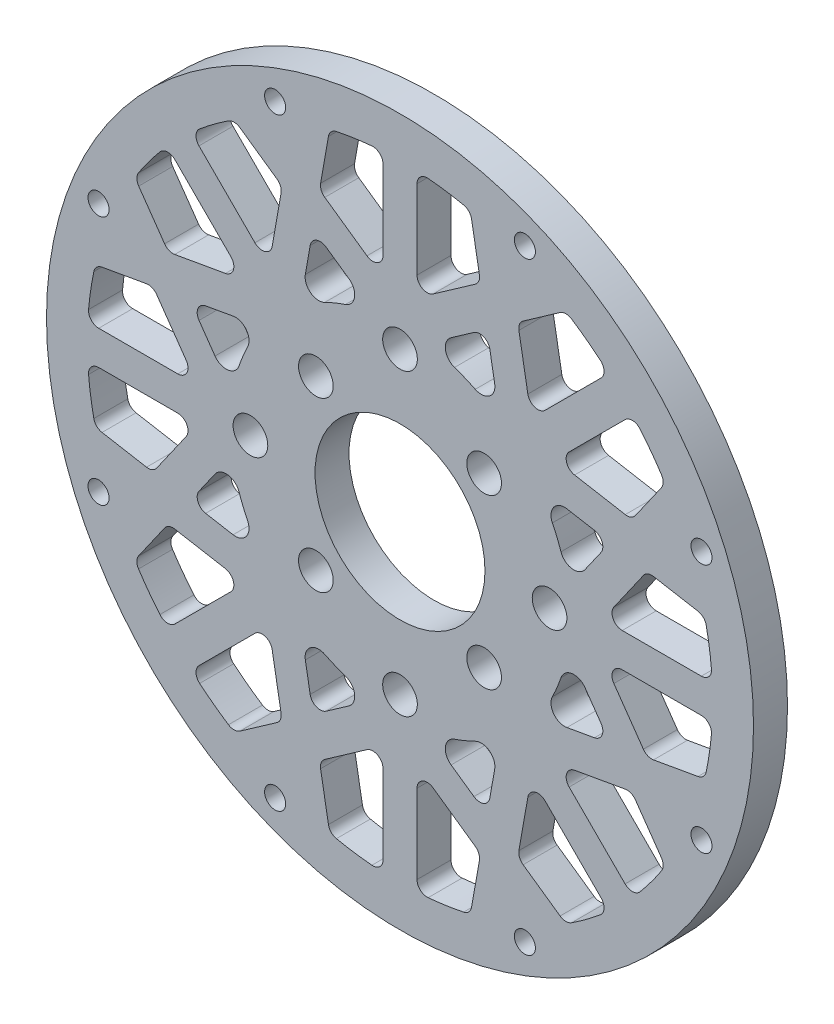
from build123d import *

# Parameters (mm, degrees)
SKETCH_1_R               = 70
EXTRUDE_1_DEPTH          = 5
SKETCH_3_R               = 12.5
CUT_EXTRUDE_2_DEPTH      = 100.121138008
SKETCH_4_R               = 65
SKETCH_4_R_2             = 25
CUT_EXTRUDE_3_DEPTH      = 100.121138008
EXTRUDE_START            = -5
EXTRUDE_4_DEPTH          = 5
SKETCH_8_R               = 65
SKETCH_8_R_2             = 59
EXTRUDE_2_DEPTH          = 5
FILLET_1_R               = 2
FILLET_2_R               = 1.5
FILLET_3_R               = 1.5
SKETCH_9_R               = 1.5
CUT_EXTRUDE_4_DEPTH      = 100.121138008
PATTERN_CIRCULAR_2_COUNT = 18
SKETCH_2_R               = 2.55
CUT_EXTRUDE_1_DEPTH      = 100.121138008
PATTERN_CIRCULAR_1_COUNT = 4
SKETCH_10_R              = 70
SKETCH_10_R_2            = 52
CUT_EXTRUDE_5_DEPTH      = 100.121138008
SKETCH_11_R              = 52
SKETCH_11_R_2            = 46
EXTRUDE_3_DEPTH          = 5
SKETCH_12_R              = 1.55
CUT_EXTRUDE_6_DEPTH      = 74.708886845
PATTERN_CIRCULAR_3_COUNT = 8
EXTRUDE_4_2_DEPTH        = 5
FILLET_4_R               = 1.5


# Read off the part's stored shape, not the designer's step: 拉伸-薄壁4
with BuildPart() as part:
    # 草图1 → 凸台-拉伸1 (new body)
    with BuildSketch(Plane.XY):
        Circle(SKETCH_1_R)
    extrude(amount=EXTRUDE_1_DEPTH)

    # 草图3 → 切除-拉伸2 (cut, through all)
    with BuildSketch(Plane.XY.offset(5)):
        Circle(SKETCH_3_R)
    extrude(amount=-CUT_EXTRUDE_2_DEPTH, mode=Mode.SUBTRACT)

    # 草图4 → 切除-拉伸3 (cut, through all)
    with BuildSketch(Plane.XY.offset(5)):
        Circle(SKETCH_4_R)
        Circle(SKETCH_4_R_2, mode=Mode.SUBTRACT)
    extrude(amount=-CUT_EXTRUDE_3_DEPTH, mode=Mode.SUBTRACT)


with BuildPart() as cut_extrude_3_piece_1:
    # of the separate pieces the step leaves, piece 1, a body of its own (cut_extrude_3_pieces)
    add(part.part.solids().sort_by_distance((70, 0, 0))[0])



with BuildPart() as cut_extrude_3_piece_2:
    # of the separate pieces the step leaves, piece 2, a body of its own (cut_extrude_3_pieces)
    add(part.part.solids().sort_by_distance((25, 0, 0))[0])


with BuildPart() as cut_extrude_3_piece_1_1:
    add(cut_extrude_3_piece_1.part)

    add(cut_extrude_3_piece_2.part)  # Extrude 4 merges 切除-拉伸3 piece 2
    # Extrude 4 outline → Extrude 4 (add)
    with BuildSketch(Plane.XY.offset(5).offset(EXTRUDE_START)):
        with BuildLine():
            Line((-17.324297637, 34.078667328), (-19.305751298, 22.841285204))
            Line((-19.305751298, 22.841285204), (-44.160165724, 47.69569963))
            ThreePointArc((-44.160165724, 47.69569963), (-45.961940777, 45.961940777), (-47.69569963, 44.160165724))
            Line((-47.69569963, 44.160165724), (-22.841285204, 19.305751298))
            Line((-22.841285204, 19.305751298), (-34.078667328, 17.324297637))
            Line((-34.078667328, 17.324297637), (-50.111128196, 40.221024669))
            Line((-50.111128196, 40.221024669), (-52.159008306, 38.787083578))
            ThreePointArc((-52.159008306, 38.787083578), (-52.939605533, 37.714694299), (-53.698157945, 36.626600078))
            Line((-53.698157945, 36.626600078), (-39.511742973, 16.366299813))
            Line((-39.511742973, 16.366299813), (-63.869248907, 12.071414334))
            ThreePointArc((-63.869248907, 12.071414334), (-64.102270154, 10.765637977), (-64.308598294, 9.455378653))
            Line((-64.308598294, 9.455378653), (-63.87447785, 6.993359271))
            Line((-63.87447785, 6.993359271), (-36.3473851, 11.847128423))
            Line((-36.3473851, 11.847128423), (-29.802455317, 2.5))
            Line((-29.802455317, 2.5), (-64.951905284, 2.5))
            ThreePointArc((-64.951905284, 2.5), (-65, 0), (-64.951905284, -2.5))
            Line((-64.951905284, -2.5), (-29.802455317, -2.5))
            Line((-29.802455317, -2.5), (-36.3473851, -11.847128423))
            Line((-36.3473851, -11.847128423), (-63.87447785, -6.993359271))
            Line((-63.87447785, -6.993359271), (-64.308598294, -9.455378653))
            ThreePointArc((-64.308598294, -9.455378653), (-64.102270154, -10.765637977), (-63.869248907, -12.071414334))
            Line((-63.869248907, -12.071414334), (-39.511742973, -16.366299813))
            Line((-39.511742973, -16.366299813), (-53.698157945, -36.626600078))
            ThreePointArc((-53.698157945, -36.626600078), (-52.939605533, -37.714694299), (-52.159008306, -38.787083578))
            Line((-52.159008306, -38.787083578), (-50.111128196, -40.221024669))
            Line((-50.111128196, -40.221024669), (-34.078667328, -17.324297637))
            Line((-34.078667328, -17.324297637), (-22.841285204, -19.305751298))
            Line((-22.841285204, -19.305751298), (-47.69569963, -44.160165724))
            ThreePointArc((-47.69569963, -44.160165724), (-45.961940777, -45.961940777), (-44.160165724, -47.69569963))
            Line((-44.160165724, -47.69569963), (-19.305751298, -22.841285204))
            Line((-19.305751298, -22.841285204), (-17.324297637, -34.078667328))
            Line((-17.324297637, -34.078667328), (-40.221024669, -50.111128196))
            Line((-40.221024669, -50.111128196), (-38.787083578, -52.159008306))
            ThreePointArc((-38.787083578, -52.159008306), (-37.714694299, -52.939605533), (-36.626600078, -53.698157945))
            Line((-36.626600078, -53.698157945), (-16.366299813, -39.511742973))
            Line((-16.366299813, -39.511742973), (-12.071414334, -63.869248907))
            ThreePointArc((-12.071414334, -63.869248907), (-10.765637977, -64.102270154), (-9.455378653, -64.308598294))
            Line((-9.455378653, -64.308598294), (-6.993359271, -63.87447785))
            Line((-6.993359271, -63.87447785), (-11.847128423, -36.3473851))
            Line((-11.847128423, -36.3473851), (-2.5, -29.802455317))
            Line((-2.5, -29.802455317), (-2.5, -64.951905284))
            ThreePointArc((-2.5, -64.951905284), (0, -65), (2.5, -64.951905284))
            Line((2.5, -64.951905284), (2.5, -29.802455317))
            Line((2.5, -29.802455317), (11.847128423, -36.3473851))
            Line((11.847128423, -36.3473851), (6.993359271, -63.87447785))
            Line((6.993359271, -63.87447785), (9.455378653, -64.308598294))
            ThreePointArc((9.455378653, -64.308598294), (10.765637977, -64.102270154), (12.071414334, -63.869248907))
            Line((12.071414334, -63.869248907), (16.366299813, -39.511742973))
            Line((16.366299813, -39.511742973), (36.626600078, -53.698157945))
            ThreePointArc((36.626600078, -53.698157945), (37.714694299, -52.939605533), (38.787083578, -52.159008306))
            Line((38.787083578, -52.159008306), (40.221024669, -50.111128196))
            Line((40.221024669, -50.111128196), (17.324297637, -34.078667328))
            Line((17.324297637, -34.078667328), (19.305751298, -22.841285204))
            Line((19.305751298, -22.841285204), (44.160165724, -47.69569963))
            ThreePointArc((44.160165724, -47.69569963), (45.961940777, -45.961940777), (47.69569963, -44.160165724))
            Line((47.69569963, -44.160165724), (22.841285204, -19.305751298))
            Line((22.841285204, -19.305751298), (34.078667328, -17.324297637))
            Line((34.078667328, -17.324297637), (50.111128196, -40.221024669))
            Line((50.111128196, -40.221024669), (52.159008306, -38.787083578))
            ThreePointArc((52.159008306, -38.787083578), (52.939605533, -37.714694299), (53.698157945, -36.626600078))
            Line((53.698157945, -36.626600078), (39.511742973, -16.366299813))
            Line((39.511742973, -16.366299813), (63.869248907, -12.071414334))
            ThreePointArc((63.869248907, -12.071414334), (64.102270154, -10.765637977), (64.308598294, -9.455378653))
            Line((64.308598294, -9.455378653), (63.87447785, -6.993359271))
            Line((63.87447785, -6.993359271), (36.3473851, -11.847128423))
            Line((36.3473851, -11.847128423), (29.802455317, -2.5))
            Line((29.802455317, -2.5), (64.951905284, -2.5))
            ThreePointArc((64.951905284, -2.5), (65, 0), (64.951905284, 2.5))
            Line((64.951905284, 2.5), (29.802455317, 2.5))
            Line((29.802455317, 2.5), (36.3473851, 11.847128423))
            Line((36.3473851, 11.847128423), (63.87447785, 6.993359271))
            Line((63.87447785, 6.993359271), (64.308598294, 9.455378653))
            ThreePointArc((64.308598294, 9.455378653), (64.102270154, 10.765637977), (63.869248907, 12.071414334))
            Line((63.869248907, 12.071414334), (39.511742973, 16.366299813))
            Line((39.511742973, 16.366299813), (53.698157945, 36.626600078))
            ThreePointArc((53.698157945, 36.626600078), (52.939605533, 37.714694299), (52.159008306, 38.787083578))
            Line((52.159008306, 38.787083578), (50.111128196, 40.221024669))
            Line((50.111128196, 40.221024669), (34.078667328, 17.324297637))
            Line((34.078667328, 17.324297637), (22.841285204, 19.305751298))
            Line((22.841285204, 19.305751298), (47.69569963, 44.160165724))
            ThreePointArc((47.69569963, 44.160165724), (45.961940777, 45.961940777), (44.160165724, 47.69569963))
            Line((44.160165724, 47.69569963), (19.305751298, 22.841285204))
            Line((19.305751298, 22.841285204), (17.324297637, 34.078667328))
            Line((17.324297637, 34.078667328), (40.221024669, 50.111128196))
            Line((40.221024669, 50.111128196), (38.787083578, 52.159008306))
            ThreePointArc((38.787083578, 52.159008306), (37.714694299, 52.939605533), (36.626600078, 53.698157945))
            Line((36.626600078, 53.698157945), (16.366299813, 39.511742973))
            Line((16.366299813, 39.511742973), (12.071414334, 63.869248907))
            ThreePointArc((12.071414334, 63.869248907), (10.765637977, 64.102270154), (9.455378653, 64.308598294))
            Line((9.455378653, 64.308598294), (6.993359271, 63.87447785))
            Line((6.993359271, 63.87447785), (11.847128423, 36.3473851))
            Line((11.847128423, 36.3473851), (2.5, 29.802455317))
            Line((2.5, 29.802455317), (2.5, 64.951905284))
            ThreePointArc((2.5, 64.951905284), (0, 65), (-2.5, 64.951905284))
            Line((-2.5, 64.951905284), (-2.5, 29.802455317))
            Line((-2.5, 29.802455317), (-11.847128423, 36.3473851))
            Line((-11.847128423, 36.3473851), (-6.993359271, 63.87447785))
            Line((-6.993359271, 63.87447785), (-9.455378653, 64.308598294))
            ThreePointArc((-9.455378653, 64.308598294), (-10.765637977, 64.102270154), (-12.071414334, 63.869248907))
            Line((-12.071414334, 63.869248907), (-16.366299813, 39.511742973))
            Line((-16.366299813, 39.511742973), (-36.626600078, 53.698157945))
            ThreePointArc((-36.626600078, 53.698157945), (-37.714694299, 52.939605533), (-38.787083578, 52.159008306))
            Line((-38.787083578, 52.159008306), (-40.221024669, 50.111128196))
            Line((-40.221024669, 50.111128196), (-17.324297637, 34.078667328))
        make_face()
        with BuildLine():
            Line((30.914309454, -12.805126247), (20.22939531, -14.689164897))
            ThreePointArc((20.22939531, -14.689164897), (17.67766953, -17.67766953), (14.689164897, -20.22939531))
            Line((14.689164897, -20.22939531), (12.805126247, -30.914309454))
            Line((12.805126247, -30.914309454), (3.917534494, -24.691150712))
            ThreePointArc((3.917534494, -24.691150712), (0, -25), (-3.917534494, -24.691150712))
            Line((-3.917534494, -24.691150712), (-12.805126247, -30.914309454))
            Line((-12.805126247, -30.914309454), (-14.689164897, -20.22939531))
            ThreePointArc((-14.689164897, -20.22939531), (-17.67766953, -17.67766953), (-20.22939531, -14.689164897))
            Line((-20.22939531, -14.689164897), (-30.914309454, -12.805126247))
            Line((-30.914309454, -12.805126247), (-24.691150712, -3.917534494))
            ThreePointArc((-24.691150712, -3.917534494), (-25, 0), (-24.691150712, 3.917534494))
            Line((-24.691150712, 3.917534494), (-30.914309454, 12.805126247))
            Line((-30.914309454, 12.805126247), (-20.22939531, 14.689164897))
            ThreePointArc((-20.22939531, 14.689164897), (-17.67766953, 17.67766953), (-14.689164897, 20.22939531))
            Line((-14.689164897, 20.22939531), (-12.805126247, 30.914309454))
            Line((-12.805126247, 30.914309454), (-3.917534494, 24.691150712))
            ThreePointArc((-3.917534494, 24.691150712), (0, 25), (3.917534494, 24.691150712))
            Line((3.917534494, 24.691150712), (12.805126247, 30.914309454))
            Line((12.805126247, 30.914309454), (14.689164897, 20.22939531))
            ThreePointArc((14.689164897, 20.22939531), (17.67766953, 17.67766953), (20.22939531, 14.689164897))
            Line((20.22939531, 14.689164897), (30.914309454, 12.805126247))
            Line((30.914309454, 12.805126247), (24.691150712, 3.917534494))
            ThreePointArc((24.691150712, 3.917534494), (25, 0), (24.691150712, -3.917534494))
            Line((24.691150712, -3.917534494), (30.914309454, -12.805126247))
        make_face(mode=Mode.SUBTRACT)
    extrude(amount=EXTRUDE_4_DEPTH)

    # 草图8 → 凸台-拉伸2 (add, through all)
    with BuildSketch(Plane.XY.offset(5)):
        Circle(SKETCH_8_R)
        Circle(SKETCH_8_R_2, mode=Mode.SUBTRACT)
    extrude(amount=-EXTRUDE_2_DEPTH)

    # 圆角1
    fillet_1_edges = [cut_extrude_3_piece_1_1.edges().sort_by_distance(p)[0] for p in [
        (-20.22939531, 14.689164897, 2.5),
        (24.691150712, -3.917534494, 2.5),
        (24.691150712, 3.917534494, 2.5),
        (20.22939531, -14.689164897, 2.5),
        (14.689164897, -20.22939531, 2.5),
        (20.22939531, 14.689164897, 2.5),
        (14.689164897, 20.22939531, 2.5),
        (3.917534494, -24.691150712, 2.5),
        (-3.917534494, -24.691150712, 2.5),
        (3.917534494, 24.691150712, 2.5),
        (-14.689164897, -20.22939531, 2.5),
        (-20.22939531, -14.689164897, 2.5),
        (-24.691150712, -3.917534494, 2.5),
        (-24.691150712, 3.917534494, 2.5),
        (-3.917534494, 24.691150712, 2.5),
        (-14.689164897, 20.22939531, 2.5),
    ]]
    fillet(fillet_1_edges, radius=FILLET_1_R)

    # 圆角2
    fillet_2_edges = [cut_extrude_3_piece_1_1.edges().sort_by_distance(p)[0] for p in [
        (39.511742973, -16.366299813, 2.5),
        (39.511742973, 16.366299813, 2.5),
        (16.366299813, -39.511742973, 2.5),
        (16.366299813, 39.511742973, 2.5),
        (-16.366299813, -39.511742973, 2.5),
        (-39.511742973, -16.366299813, 2.5),
        (-16.366299813, 39.511742973, 2.5),
        (-39.511742973, 16.366299813, 2.5),
        (36.3473851, -11.847128423, 2.5),
        (36.3473851, 11.847128423, 2.5),
        (30.914309454, -12.805126247, 2.5),
        (34.078667328, 17.324297637, 2.5),
        (34.078667328, -17.324297637, 2.5),
        (17.324297637, -34.078667328, 2.5),
        (17.324297637, 34.078667328, 2.5),
        (12.805126247, -30.914309454, 2.5),
        (30.914309454, 12.805126247, 2.5),
        (11.847128423, 36.3473851, 2.5),
        (11.847128423, -36.3473851, 2.5),
        (-11.847128423, -36.3473851, 2.5),
        (-12.805126247, -30.914309454, 2.5),
        (12.805126247, 30.914309454, 2.5),
        (-17.324297637, -34.078667328, 2.5),
        (-34.078667328, -17.324297637, 2.5),
        (-30.914309454, -12.805126247, 2.5),
        (-11.847128423, 36.3473851, 2.5),
        (-36.3473851, -11.847128423, 2.5),
        (-36.3473851, 11.847128423, 2.5),
        (-12.805126247, 30.914309454, 2.5),
        (-30.914309454, 12.805126247, 2.5),
        (-17.324297637, 34.078667328, 2.5),
        (-34.078667328, 17.324297637, 2.5),
    ]]
    fillet(fillet_2_edges, radius=FILLET_2_R)

    # 圆角3
    fillet_3_edges = [cut_extrude_3_piece_1_1.edges().sort_by_distance(p)[0] for p in [
        (-19.305751298, 22.841285204, 2.5),
        (29.802455317, -2.5, 2.5),
        (19.305751298, -22.841285204, 2.5),
        (22.841285204, 19.305751298, 2.5),
        (-2.5, -29.802455317, 2.5),
        (-22.841285204, -19.305751298, 2.5),
        (2.5, 29.802455317, 2.5),
        (-2.5, 29.802455317, 2.5),
        (-29.802455317, 2.5, 2.5),
        (29.802455317, 2.5, 2.5),
        (22.841285204, -19.305751298, 2.5),
        (19.305751298, 22.841285204, 2.5),
        (2.5, -29.802455317, 2.5),
        (-19.305751298, -22.841285204, 2.5),
        (-29.802455317, -2.5, 2.5),
        (-22.841285204, 19.305751298, 2.5),
        (-46.958911016, 35.719191987, 2.5),
        (-39.914063621, 43.449597527, 2.5),
        (-43.449597527, 39.914063621, 2.5),
        (58.947010102, -2.5, 2.5),
        (58.947010102, 2.5, 2.5),
        (58.462247289, 7.947681545, 2.5),
        (57.505940678, -13.193437261, 2.5),
        (49.992009566, -31.333671658, 2.5),
        (57.505940678, 13.193437261, 2.5),
        (49.992009566, 31.333671658, 2.5),
        (43.449597527, -39.914063621, 2.5),
        (46.958911016, -35.719191987, 2.5),
        (39.914063621, -43.449597527, 2.5),
        (43.449597527, 39.914063621, 2.5),
        (39.914063621, 43.449597527, 2.5),
        (35.719191987, 46.958911016, 2.5),
        (31.333671658, -49.992009566, 2.5),
        (13.193437261, -57.505940678, 2.5),
        (31.333671658, 49.992009566, 2.5),
        (13.193437261, 57.505940678, 2.5),
        (2.5, -58.947010102, 2.5),
        (7.947681545, -58.462247289, 2.5),
        (-2.5, -58.947010102, 2.5),
        (-13.193437261, -57.505940678, 2.5),
        (-31.333671658, -49.992009566, 2.5),
        (-39.914063621, -43.449597527, 2.5),
        (-35.719191987, -46.958911016, 2.5),
        (-43.449597527, -39.914063621, 2.5),
        (2.5, 58.947010102, 2.5),
        (-49.992009566, -31.333671658, 2.5),
        (-57.505940678, -13.193437261, 2.5),
        (-2.5, 58.947010102, 2.5),
        (-58.947010102, -2.5, 2.5),
        (-58.462247289, -7.947681545, 2.5),
        (-58.947010102, 2.5, 2.5),
        (-31.333671658, 49.992009566, 2.5),
        (-13.193437261, 57.505940678, 2.5),
        (-35.719191987, 46.958911016, 2.5),
        (-57.505940678, 13.193437261, 2.5),
        (-49.992009566, 31.333671658, 2.5),
        (58.462247289, -7.947681545, 2.5),
        (35.719191987, -46.958911016, 2.5),
        (46.958911016, 35.719191987, 2.5),
        (-7.947681545, -58.462247289, 2.5),
        (7.947681545, 58.462247289, 2.5),
        (-46.958911016, -35.719191987, 2.5),
        (-7.947681545, 58.462247289, 2.5),
        (-58.462247289, 7.947681545, 2.5),
    ]]
    fillet(fillet_3_edges, radius=FILLET_3_R)

    # 草图9 → 切除-拉伸4 (cut, through all)
    with BuildSketch(Plane.XY.offset(5)):
        with Locations((0, 63)):
            Circle(SKETCH_9_R)
    cut_extrude_4 = extrude(amount=-CUT_EXTRUDE_4_DEPTH, mode=Mode.SUBTRACT)

    # 阵列(圆周)2: 切除-拉伸4 ×18 about axis
    pattern_circular_2_axis = Axis((0, 0, 0), (0, 0, 1))
    for i in range(1, PATTERN_CIRCULAR_2_COUNT):
        add(cut_extrude_4.rotate(pattern_circular_2_axis, i * 360 / PATTERN_CIRCULAR_2_COUNT), mode=Mode.SUBTRACT)

    # 草图2 → 切除-拉伸1 (cut, through all)
    with BuildSketch(Plane.XY.offset(5)):
        with Locations((0, 22)):
            Circle(SKETCH_2_R)
        with Locations((12.374368671, 12.374368671)):
            Circle(SKETCH_2_R)
    cut_extrude_1 = extrude(amount=-CUT_EXTRUDE_1_DEPTH, mode=Mode.SUBTRACT)

    # 阵列(圆周)1: 切除-拉伸1 ×4 about axis
    pattern_circular_1_axis = Axis((0, 0, 0), (0, 0, 1))
    for i in range(1, PATTERN_CIRCULAR_1_COUNT):
        add(cut_extrude_1.rotate(pattern_circular_1_axis, i * 360 / PATTERN_CIRCULAR_1_COUNT), mode=Mode.SUBTRACT)

    # 草图10 → 切除-拉伸5 (cut, through all)
    with BuildSketch(Plane.XY.offset(5)):
        Circle(SKETCH_10_R)
        Circle(SKETCH_10_R_2, mode=Mode.SUBTRACT)
    extrude(amount=-CUT_EXTRUDE_5_DEPTH, mode=Mode.SUBTRACT)

    # 草图11 → 凸台-拉伸3 (add, through all)
    with BuildSketch(Plane.XY.offset(5)):
        Circle(SKETCH_11_R)
        Circle(SKETCH_11_R_2, mode=Mode.SUBTRACT)
    extrude(amount=-EXTRUDE_3_DEPTH)

    # 草图12 → 切除-拉伸6 (cut, through all)
    with BuildSketch(Plane.XY.offset(5)):
        with Locations((18.368804754, 44.346217561)):
            Circle(SKETCH_12_R)
    cut_extrude_6 = extrude(amount=-CUT_EXTRUDE_6_DEPTH, mode=Mode.SUBTRACT)

    # 阵列(圆周)3: 切除-拉伸6 ×8 about axis
    pattern_circular_3_axis = Axis((0, 0, 0), (0, 0, 1))
    for i in range(1, PATTERN_CIRCULAR_3_COUNT):
        add(cut_extrude_6.rotate(pattern_circular_3_axis, i * 360 / PATTERN_CIRCULAR_3_COUNT), mode=Mode.SUBTRACT)

    # 草图13 → Extrude 4 2 (add, through all)
    with BuildSketch(Plane.XY.offset(5)):
        with BuildLine():
            Line((43.234225249, 15.709925752), (41.830500762, 15.957440253))
            ThreePointArc((41.830500762, 15.957440253), (40.70515373, 16.860626734), (40.862244962, 18.295016537))
            Line((40.862244962, 18.295016537), (41.679808884, 19.462618822))
            ThreePointArc((41.679808884, 19.462618822), (42.498458496, 17.603437889), (43.234225249, 15.709925752))
        make_face()
        with BuildLine():
            Line((41.679808884, -19.462618822), (40.862244962, -18.295016537))
            ThreePointArc((40.862244962, -18.295016537), (40.70515373, -16.860626734), (41.830500762, -15.957440253))
            Line((41.830500762, -15.957440253), (43.234225249, -15.709925752))
            ThreePointArc((43.234225249, -15.709925752), (42.498458496, -17.603437889), (41.679808884, -19.462618822))
        make_face()
        with BuildLine():
            Line((15.709925752, -43.234225249), (15.957440253, -41.830500762))
            ThreePointArc((15.957440253, -41.830500762), (16.860626734, -40.70515373), (18.295016537, -40.862244962))
            Line((18.295016537, -40.862244962), (19.462618822, -41.679808884))
            ThreePointArc((19.462618822, -41.679808884), (17.603437889, -42.498458496), (15.709925752, -43.234225249))
        make_face()
        with BuildLine():
            Line((-19.462618822, -41.679808884), (-18.295016537, -40.862244962))
            ThreePointArc((-18.295016537, -40.862244962), (-16.860626734, -40.70515373), (-15.957440253, -41.830500762))
            Line((-15.957440253, -41.830500762), (-15.709925752, -43.234225249))
            ThreePointArc((-15.709925752, -43.234225249), (-17.603437889, -42.498458496), (-19.462618822, -41.679808884))
        make_face()
        with BuildLine():
            Line((-43.234225249, -15.709925752), (-41.830500762, -15.957440253))
            ThreePointArc((-41.830500762, -15.957440253), (-40.70515373, -16.860626734), (-40.862244962, -18.295016537))
            Line((-40.862244962, -18.295016537), (-41.679808884, -19.462618822))
            ThreePointArc((-41.679808884, -19.462618822), (-42.498458496, -17.603437889), (-43.234225249, -15.709925752))
        make_face()
        with BuildLine():
            Line((-43.234225249, 15.709925752), (-41.830500762, 15.957440253))
            ThreePointArc((-41.830500762, 15.957440253), (-40.70515373, 16.860626734), (-40.862244962, 18.295016537))
            Line((-40.862244962, 18.295016537), (-41.679808884, 19.462618822))
            ThreePointArc((-41.679808884, 19.462618822), (-42.498458496, 17.603437889), (-43.234225249, 15.709925752))
        make_face()
        with BuildLine():
            Line((-15.957440253, 41.830500762), (-15.709925752, 43.234225249))
            ThreePointArc((-15.709925752, 43.234225249), (-17.603437889, 42.498458496), (-19.462618822, 41.679808884))
            Line((-19.462618822, 41.679808884), (-18.295016537, 40.862244962))
            ThreePointArc((-18.295016537, 40.862244962), (-16.860626734, 40.70515373), (-15.957440253, 41.830500762))
        make_face()
        with BuildLine():
            Line((19.462618822, 41.679808884), (18.295016537, 40.862244962))
            ThreePointArc((18.295016537, 40.862244962), (16.860626734, 40.70515373), (15.957440253, 41.830500762))
            Line((15.957440253, 41.830500762), (15.709925752, 43.234225249))
            ThreePointArc((15.709925752, 43.234225249), (17.603437889, 42.498458496), (19.462618822, 41.679808884))
        make_face()
    extrude(amount=-EXTRUDE_4_2_DEPTH)

    # 圆角4
    fillet_4_edges = [cut_extrude_3_piece_1_1.edges().sort_by_distance(p)[0] for p in [
        (-30.711072312, 34.246606218, 2.5),
        (-34.246606218, 30.711072312, 2.5),
        (-39.01318803, 24.371523542, 2.5),
        (45.932014979, -2.5, 2.5),
        (45.932014979, 2.5, 2.5),
        (44.819759376, 10.353220248, 2.5),
        (34.246606218, -30.711072312, 2.5),
        (39.01318803, -24.371523542, 2.5),
        (30.711072312, -34.246606218, 2.5),
        (34.246606218, 30.711072312, 2.5),
        (30.711072312, 34.246606218, 2.5),
        (24.371523542, 39.01318803, 2.5),
        (2.5, -45.932014979, 2.5),
        (10.353220248, -44.819759376, 2.5),
        (-2.5, -45.932014979, 2.5),
        (-30.711072312, -34.246606218, 2.5),
        (-24.371523542, -39.01318803, 2.5),
        (-34.246606218, -30.711072312, 2.5),
        (2.5, 45.932014979, 2.5),
        (-2.5, 45.932014979, 2.5),
        (-45.932014979, -2.5, 2.5),
        (-44.819759376, -10.353220248, 2.5),
        (-45.932014979, 2.5, 2.5),
        (-24.371523542, 39.01318803, 2.5),
        (44.819759376, -10.353220248, 2.5),
        (24.371523542, -39.01318803, 2.5),
        (39.01318803, 24.371523542, 2.5),
        (-10.353220248, -44.819759376, 2.5),
        (10.353220248, 44.819759376, 2.5),
        (-39.01318803, -24.371523542, 2.5),
        (-10.353220248, 44.819759376, 2.5),
        (-44.819759376, 10.353220248, 2.5),
    ]]
    fillet(fillet_4_edges, radius=FILLET_4_R)


solid = cut_extrude_3_piece_1_1.part
